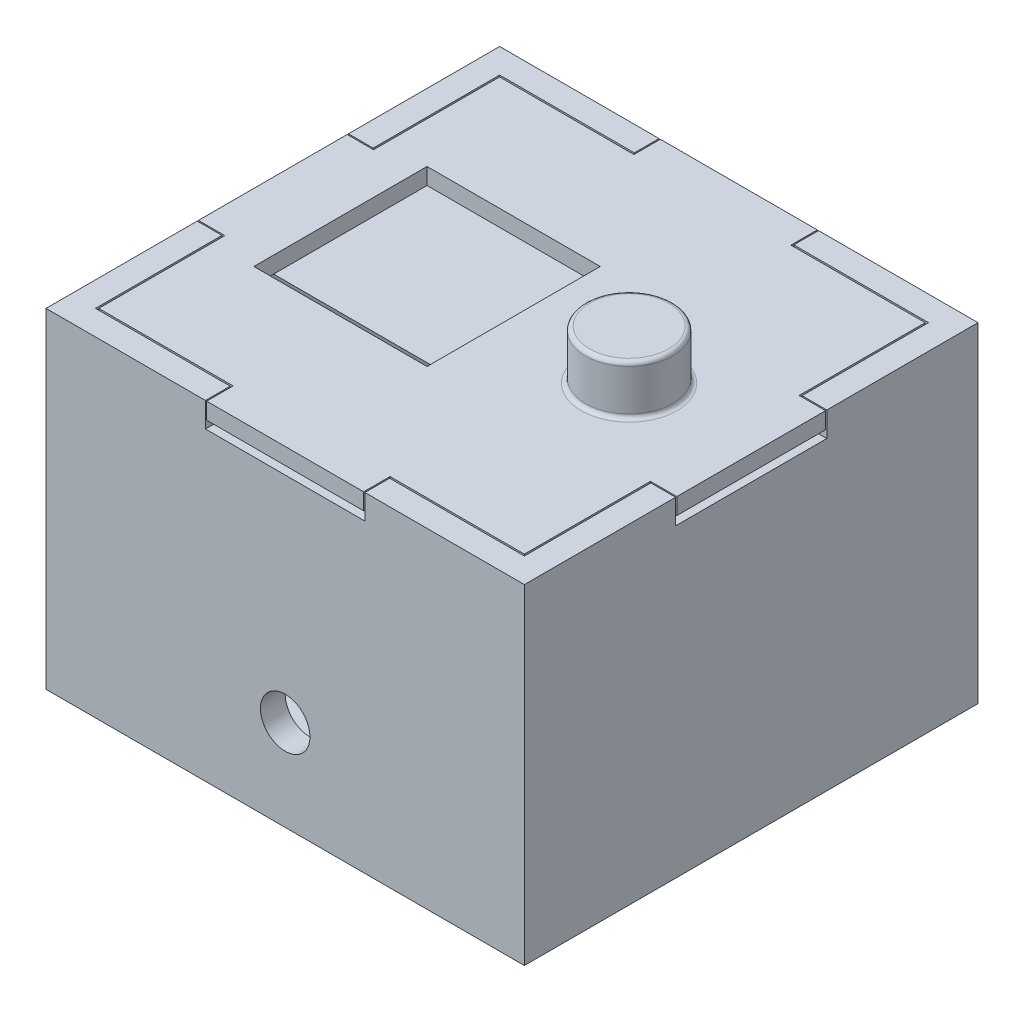
from build123d import *

# Parameters (mm, degrees)
SKETCH1_W           = 58
SKETCH1_H           = 55
BOSS_EXTRUDE1_DEPTH = 40
SHELL1_T            = -3
SKETCH2_W           = 18.333333334
SKETCH2_H           = 3
CUT_EXTRUDE1_DEPTH  = 76.632334355
SKETCH3_W           = 19.333333334
SKETCH3_H           = 3
CUT_EXTRUDE2_DEPTH  = 74.932401557
SKETCH4_W           = 19.033333334
SKETCH4_H           = 3
BOSS_EXTRUDE2_DEPTH = 55
BOSS_EXTRUDE3_START = -58
SKETCH5_W           = 18.033333334
SKETCH5_H           = 3
BOSS_EXTRUDE3_DEPTH = 58
SKETCH6_W           = 51.6
SKETCH6_H           = 48.6
BOSS_EXTRUDE4_DEPTH = 3
SKETCH7_W           = 21
SKETCH7_H           = 21
CUT_EXTRUDE3_DEPTH  = 2
SKETCH8_W           = 21
SKETCH8_H           = 2.4
CUT_EXTRUDE4_DEPTH  = 1
SKETCH9_R           = 4.3
CUT_EXTRUDE5_DEPTH  = 3
SKETCH10_W          = 10
SKETCH10_H          = 6
CUT_EXTRUDE6_DEPTH  = 3
SKETCH11_R          = 3
CUT_EXTRUDE7_DEPTH  = 72.728655362
SKETCH12_R          = 5.3
SKETCH12_R_2        = 4.3
BOSS_EXTRUDE5_DEPTH = 5
SKETCH13_R          = 5.3
BOSS_EXTRUDE6_DEPTH = 1
FILLET1_R           = 0.5
CHAMFER1_SIZE       = 1


with BuildPart() as part:
    # Sketch1 → Boss-Extrude1 (new body)
    with BuildSketch(Plane(origin=(0, 0, 0), x_dir=(1, 0, 0), z_dir=(0, 1, 0))):
        Rectangle(SKETCH1_W, SKETCH1_H)
    extrude(amount=BOSS_EXTRUDE1_DEPTH)

    # Shell1
    shell1_openings = [part.faces().sort_by_distance(p)[0] for p in [
        (0, 40, 0),
    ]]
    offset(amount=SHELL1_T, openings=shell1_openings, kind=Kind.INTERSECTION)

    # Sketch2 → Cut-Extrude1 (cut, through all)
    with BuildSketch(Plane(origin=(29, 0, 0), x_dir=(0, 0, -1), z_dir=(1, 0, 0))):
        with Locations((0, 38.5)):
            Rectangle(SKETCH2_W, SKETCH2_H)
    extrude(amount=-CUT_EXTRUDE1_DEPTH, mode=Mode.SUBTRACT)

    # Sketch3 → Cut-Extrude2 (cut, through all)
    with BuildSketch(Plane(origin=(0, 0, -27.5), x_dir=(-1, 0, 0), z_dir=(0, 0, -1))):
        with Locations((0, 38.5)):
            Rectangle(SKETCH3_W, SKETCH3_H)
    extrude(amount=-CUT_EXTRUDE2_DEPTH, mode=Mode.SUBTRACT)

    # Sketch10 → Cut-Extrude6 (cut)
    with BuildSketch(Plane(origin=(0, 0, -27.5), x_dir=(-1, 0, 0), z_dir=(0, 0, -1))):
        with Locations((0, 11)):
            Rectangle(SKETCH10_W, SKETCH10_H)
    extrude(amount=-CUT_EXTRUDE6_DEPTH, mode=Mode.SUBTRACT)

    # Sketch11 → Cut-Extrude7 (cut, through all)
    with BuildSketch(Plane(origin=(0, 0, 24.5), x_dir=(-1, 0, 0), z_dir=(0, 0, -1))):
        with Locations((0, 11)):
            Circle(SKETCH11_R)
    extrude(amount=-CUT_EXTRUDE7_DEPTH, mode=Mode.SUBTRACT)


with BuildPart() as body_2:
    # Sketch4 → Boss-Extrude2 (new, through all)
    with BuildSketch(Plane(origin=(0, 0, -27.5), x_dir=(-1, 0, 0), z_dir=(0, 0, -1))):
        with Locations((0, 38.5)):
            Rectangle(SKETCH4_W, SKETCH4_H)
    extrude(amount=-BOSS_EXTRUDE2_DEPTH)

    # Sketch5 → Boss-Extrude3 (add)
    with BuildSketch(Plane.ZY.offset(29).offset(BOSS_EXTRUDE3_START)):
        with Locations((0, 38.5)):
            Rectangle(SKETCH5_W, SKETCH5_H)
    extrude(amount=BOSS_EXTRUDE3_DEPTH)

    # Sketch6 → Boss-Extrude4 (add)
    with BuildSketch(Plane(origin=(0, 40, 0), x_dir=(1, 0, 0), z_dir=(0, 1, 0))):
        Rectangle(SKETCH6_W, SKETCH6_H)
    extrude(amount=-BOSS_EXTRUDE4_DEPTH)

    # Sketch7 → Cut-Extrude3 (cut)
    with BuildSketch(Plane(origin=(0, 40, 0), x_dir=(1, 0, 0), z_dir=(0, 1, 0))):
        with Locations((-10.3, 0)):
            Rectangle(SKETCH7_W, SKETCH7_H)
    extrude(amount=-CUT_EXTRUDE3_DEPTH, mode=Mode.SUBTRACT)

    # Sketch8 → Cut-Extrude4 (cut)
    with BuildSketch(Plane(origin=(0, 38, 0), x_dir=(1, 0, 0), z_dir=(0, 1, 0))):
        with Locations((-10.3, -9.3)):
            Rectangle(SKETCH8_W, SKETCH8_H)
    extrude(amount=-CUT_EXTRUDE4_DEPTH, mode=Mode.SUBTRACT)

    # Sketch9 → Cut-Extrude5 (cut)
    with BuildSketch(Plane(origin=(0, 40, 0), x_dir=(1, 0, 0), z_dir=(0, 1, 0))):
        with Locations(Location((14.2, 0, 0), (0, 0, 270))):
            Circle(SKETCH9_R)
    extrude(amount=-CUT_EXTRUDE5_DEPTH, mode=Mode.SUBTRACT)

    # Sketch12 → Boss-Extrude5 (add)
    with BuildSketch(Plane(origin=(0, 40, 0), x_dir=(1, 0, 0), z_dir=(0, 1, 0))):
        with Locations(Location((14.2, 0, 0), (0, 0, 270))):
            Circle(SKETCH12_R)
        with Locations(Location((14.2, 0, 0), (0, 0, 270))):
            Circle(SKETCH12_R_2, mode=Mode.SUBTRACT)
    extrude(amount=BOSS_EXTRUDE5_DEPTH)

    # Sketch13 → Boss-Extrude6 (add)
    with BuildSketch(Plane(origin=(0, 45, 0), x_dir=(1, 0, 0), z_dir=(0, 1, 0))):
        with Locations(Location((14.2, 0, 0), (0, 0, 270))):
            Circle(SKETCH13_R)
    extrude(amount=BOSS_EXTRUDE6_DEPTH)

    # Fillet1
    fillet1_edges = [body_2.edges().sort_by_distance(p)[0] for p in [
        (14.2, 40, -5.3),
        (14.2, 46, -5.3),
    ]]
    fillet(fillet1_edges, radius=FILLET1_R)

    # Chamfer1
    chamfer1_edges = [body_2.edges().sort_by_distance(p)[0] for p in [
        (0, 37, -27.5),
        (-9.516666667, 37, -25.9),
        (-17.658333333, 37, -24.3),
        (-25.8, 37, -16.658333333),
        (-27.4, 37, -9.016666667),
        (-29, 37, 0),
        (-27.4, 37, 9.016666667),
        (-25.8, 37, 16.658333333),
        (-17.658333333, 37, 24.3),
        (-9.516666667, 37, 25.9),
        (0, 37, 27.5),
        (9.516666667, 37, 25.9),
        (17.658333333, 37, 24.3),
        (25.8, 37, 16.658333333),
        (27.4, 37, 9.016666667),
        (29, 37, 0),
        (27.4, 37, -9.016666667),
        (25.8, 37, -16.658333333),
        (17.658333333, 37, -24.3),
        (9.516666667, 37, -25.9),
        (-10.3, 37, 8.1),
        (0.2, 37, 9.3),
        (-10.3, 37, 10.5),
        (-20.8, 37, 9.3),
        (14.2, 37, -4.3),
    ]]
    chamfer(chamfer1_edges, length=CHAMFER1_SIZE - 0.0001)  # a hair under: the kernel refuses the full size


solid = Compound([part.part, body_2.part])
